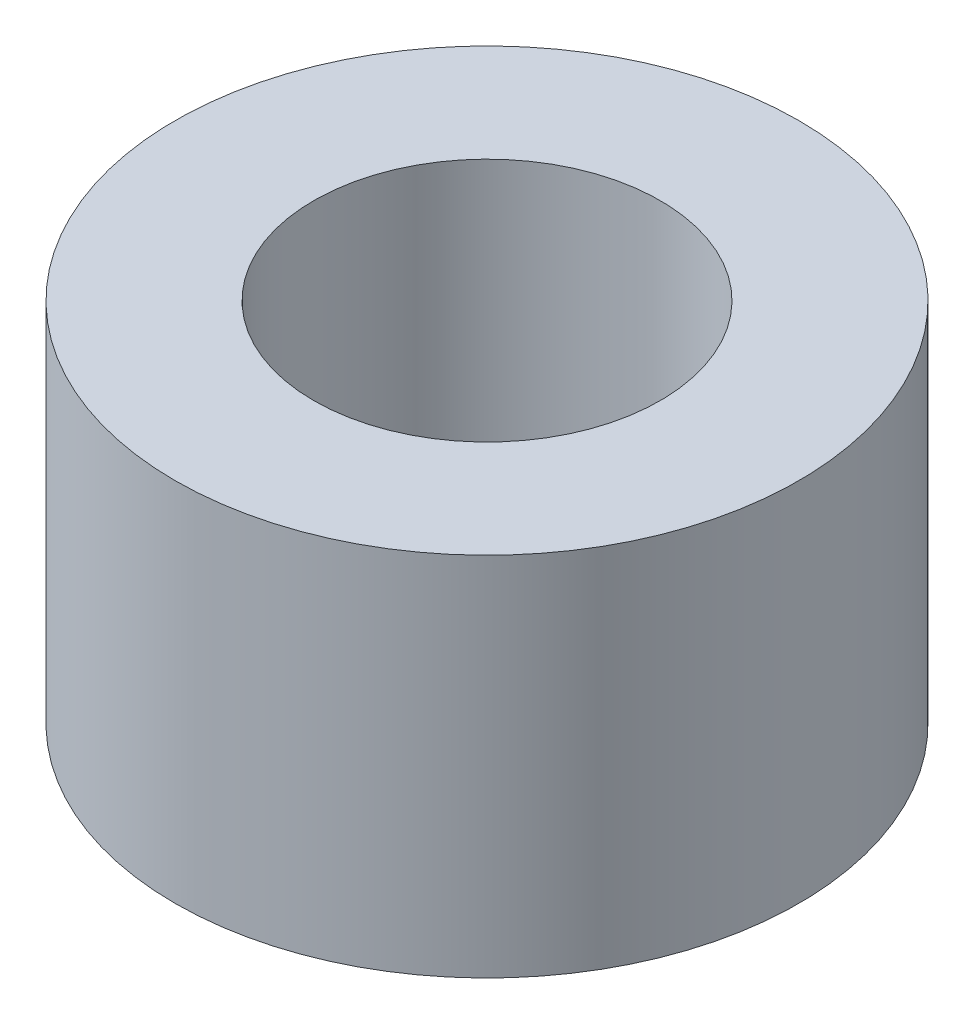
from build123d import *

# Parameters (mm, degrees)
SKETCH1_R           = 5.4
SKETCH1_R_2         = 3
BOSS_EXTRUDE1_DEPTH = 6.34


with BuildPart() as part:
    # Sketch1 → Boss-Extrude1 (new body)
    with BuildSketch(Plane(origin=(0, 0, 0), x_dir=(1, 0, 0), z_dir=(0, 1, 0))):
        Circle(SKETCH1_R)
        Circle(SKETCH1_R_2, mode=Mode.SUBTRACT)
    extrude(amount=BOSS_EXTRUDE1_DEPTH)


solid = part.part
